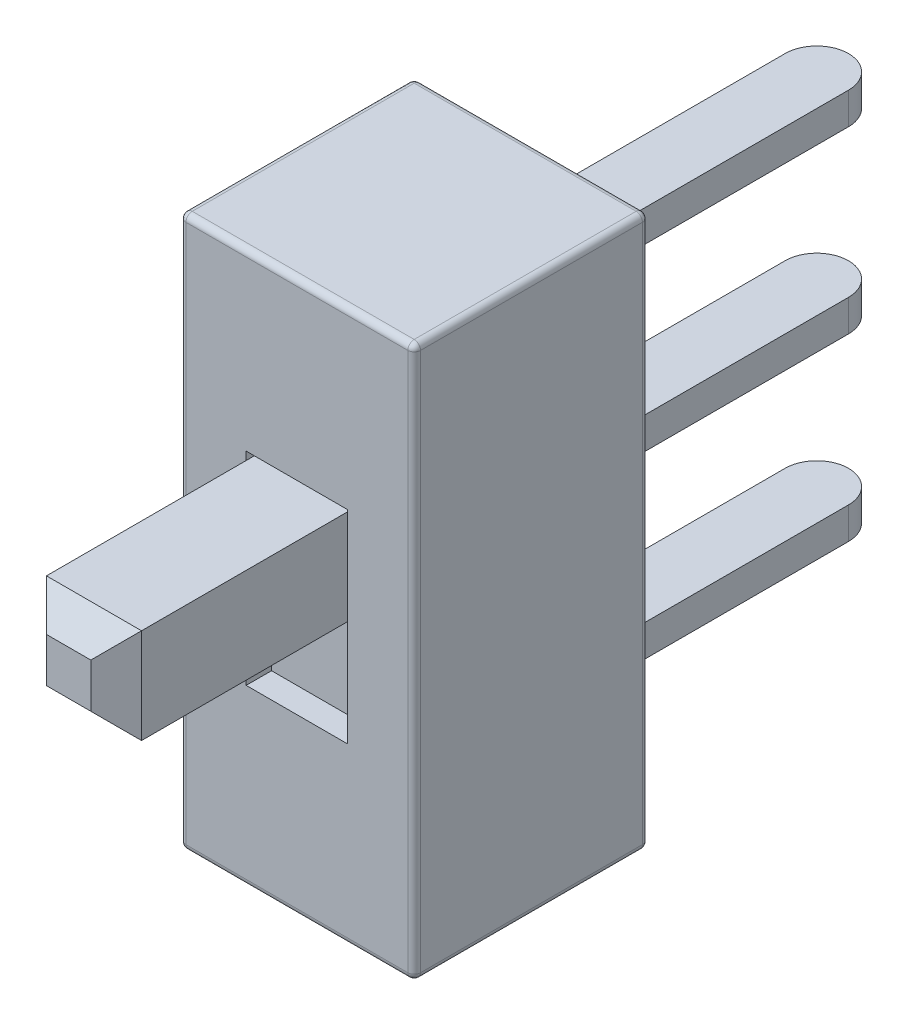
from build123d import *

# Parameters (mm, degrees)
SKIZZE1_W                       = 8.7
SKIZZE1_H                       = 3.7
AUFSATZ_LINEAR_AUSTRAGEN1_DEPTH = 3.7
VERRUNDUNG1_R                   = 0.1
SKIZZE2_W                       = 1.6
SKIZZE2_H                       = 3.2
SCHNITT_LINEAR_AUSTRAGEN1_DEPTH = 0.4
SKIZZE3_W                       = 1.5
SKIZZE3_H                       = 1.5
AUFSATZ_LINEAR_AUSTRAGEN2_DEPTH = 4
FASE1_SIZE                      = 0.4
SKIZZE4_W                       = 1
SKIZZE4_H                       = 0.5
AUFSATZ_LINEAR_AUSTRAGEN3_DEPTH = 5
VERRUNDUNG2_R                   = 0.5


with BuildPart() as part:
    # Skizze1 → Aufsatz-Linear austragen1 (new body)
    with BuildSketch(Plane(origin=(0, 0, 0), x_dir=(0, 1, 0), z_dir=(0, 0, 1))):
        Rectangle(SKIZZE1_W, SKIZZE1_H)
    extrude(amount=AUFSATZ_LINEAR_AUSTRAGEN1_DEPTH)

    # Verrundung1
    verrundung1_edges = [part.edges().sort_by_distance(p)[0] for p in [
        (0, -4.35, 3.7),
        (1.85, 0, 3.7),
        (0, 4.35, 3.7),
        (1.85, 0, 0),
        (0, -4.35, 0),
        (-1.85, 0, 0),
        (0, 4.35, 0),
        (1.85, 4.35, 1.85),
        (1.85, -4.35, 1.85),
        (-1.85, -4.35, 1.85),
        (-1.85, 4.35, 1.85),
        (-1.85, 0, 3.7),
    ]]
    fillet(verrundung1_edges, radius=VERRUNDUNG1_R)

    # Skizze2 → Schnitt-Linear austragen1 (cut)
    with BuildSketch(Plane.XY.offset(3.7)):
        Rectangle(SKIZZE2_W, SKIZZE2_H)
    extrude(amount=-SCHNITT_LINEAR_AUSTRAGEN1_DEPTH, mode=Mode.SUBTRACT)

    # Skizze3 → Aufsatz-Linear austragen2 (add)
    with BuildSketch(Plane.XY.offset(3.3)):
        with Locations((0, 0.770929874)):
            Rectangle(SKIZZE3_W, SKIZZE3_H)
    extrude(amount=AUFSATZ_LINEAR_AUSTRAGEN2_DEPTH)

    # Fase1
    fase1_edges = [part.edges().sort_by_distance(p)[0] for p in [
        (0.75, 0.770929874, 7.3),
        (0, 1.520929874, 7.3),
        (-0.75, 0.770929874, 7.3),
        (0, 0.020929874, 7.3),
    ]]
    chamfer(fase1_edges, length=FASE1_SIZE)

    # Skizze4 → Aufsatz-Linear austragen3 (add)
    with BuildSketch(Plane(origin=(0, 0, 0), x_dir=(1, 0, 0), z_dir=(0, 0, -1))):
        with Locations((0, 2.835)):
            Rectangle(SKIZZE4_W, SKIZZE4_H)
        Rectangle(SKIZZE4_W, SKIZZE4_H)
        with Locations((0, -2.83)):
            Rectangle(SKIZZE4_W, SKIZZE4_H)
    extrude(amount=AUFSATZ_LINEAR_AUSTRAGEN3_DEPTH)

    # Verrundung2
    verrundung2_edges = [part.edges().sort_by_distance(p)[0] for p in [
        (-0.5, 2.83, -5),
        (0.5, 2.83, -5),
        (-0.5, 0, -5),
        (0.5, 0, -5),
        (-0.5, -2.835, -5),
        (0.5, -2.835, -5),
    ]]
    fillet(verrundung2_edges, radius=VERRUNDUNG2_R - 0.0001)  # a hair under: the kernel refuses the full size


solid = part.part
